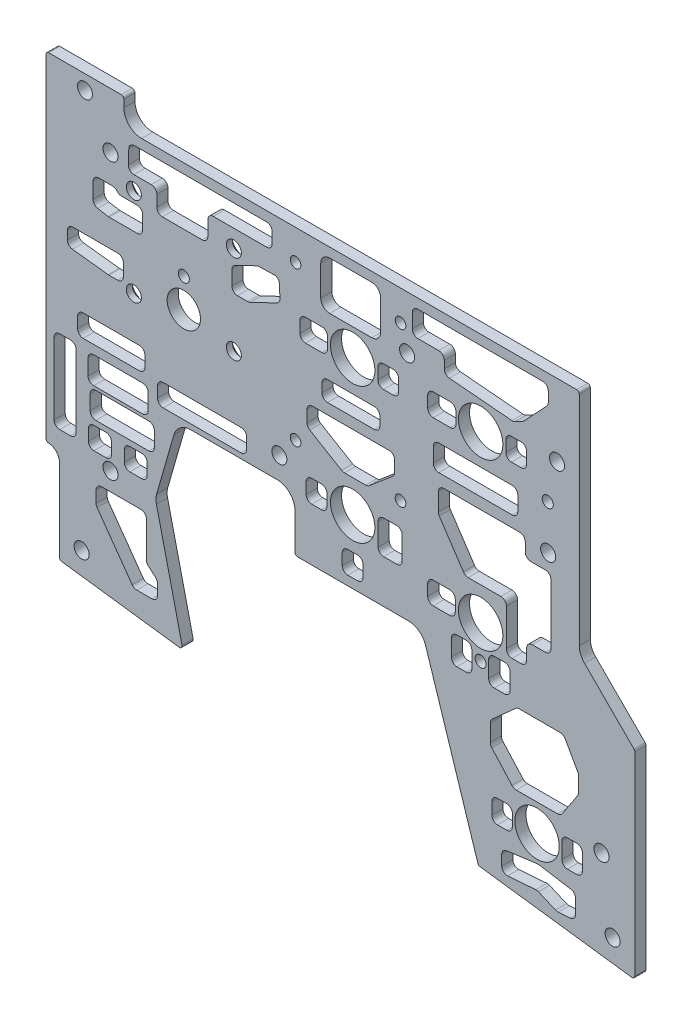
from build123d import *

# Parameters (mm, degrees)
BOSS_EXTRUDE1_DEPTH                       = 3.175
F_6_CLEARANCE_HOLE1_D                     = 4.3053
SKETCH4_R                                 = 6.35
SKETCH4_R_2                               = 1.5875
SKETCH4_R_3                               = 4.7625
CUT_EXTRUDE1_DEPTH                        = 218.405084842
CSK_FOR_6_FLAT_HEAD_MACHINE_SCREW_2_COUNT = 2
CSK_FOR_6_FLAT_HEAD_MACHINE_SCREW_2_PITCH = 28.575
CSK_FOR_6_FLAT_HEAD_MACHINE_SCREW_3_COUNT = 2
CSK_FOR_6_FLAT_HEAD_MACHINE_SCREW_3_PITCH = 38.232062788
CSK_FOR_6_FLAT_HEAD_MACHINE_SCREW_4_COUNT = 2
CSK_FOR_6_FLAT_HEAD_MACHINE_SCREW_4_PITCH = 25.4
F_0_CLEARANCE_HOLE1_D                     = 1.8542
F_1_8_0_125_DIAMETER_HOLE1_D              = 3.175
SKETCH17_R                                = 1.5875
BACKLIGHTING_HOLES_DEPTH                  = 218.405084842
SKETCH20_R                                = 1.52
SKETCH20_R_2                              = 1.520000008
SWITCH_PCB_MOUNTING_HOLES_DEPTH           = 218.405084844


with BuildPart() as part:
    # Sketch1 → Boss-Extrude1 (new body)
    with BuildSketch(Plane.XY):
        with BuildLine():
            Line((3.809986215, -91.884500325), (3.80998361, -115.403340545))
            ThreePointArc((3.80998361, -115.403340545), (3.999081622, -115.90576205), (4.472522544, -116.158821571))
            Line((4.472522544, -116.158821571), (38.023104274, -120.5758443))
            ThreePointArc((38.023104274, -120.5758443), (38.687459595, -120.33177166), (38.864463259, -119.646491316))
            Line((38.864463259, -119.646491316), (31.544635998, -88.413376307))
            ThreePointArc((31.544635998, -88.413376307), (31.412233483, -87.126289027), (31.609278422, -85.84750156))
            Line((31.609278422, -85.84750156), (36.533410401, -68.760772014))
            ThreePointArc((36.533410401, -68.760772014), (38.360231081, -66.108400459), (41.414754107, -65.0875))
            Line((41.414754107, -65.0875), (66.039990754, -65.0875))
            ThreePointArc((66.039990754, -65.0875), (69.632093202, -66.575397552), (71.119990754, -70.1675))
            Line((71.119990754, -70.1675), (71.119990754, -80.518))
            ThreePointArc((71.119990754, -80.518), (71.343175387, -81.056815367), (71.881990754, -81.28))
            Line((71.881990754, -81.28), (103.612235862, -81.28))
            ThreePointArc((103.612235862, -81.28), (106.604490402, -82.25478225), (108.448399818, -84.805034342))
            Line((108.448399818, -84.805034342), (123.423319929, -131.379161885))
            ThreePointArc((123.423319929, -131.379161885), (123.660593225, -131.731025839), (124.049283564, -131.901398021))
            Line((124.049283564, -131.901398021), (167.413526593, -137.610408921))
            ThreePointArc((167.413526593, -137.610408921), (168.015409063, -137.42782987), (168.274987552, -136.854927937))
            Line((168.274987552, -136.854927937), (168.274987552, -81.303553632))
            ThreePointArc((168.274987552, -81.303553632), (168.216983776, -81.011948907), (168.051802995, -80.764738341))
            Line((168.051802995, -80.764738341), (153.88788809, -66.600819412))
            ThreePointArc((153.88788809, -66.600819412), (152.786682817, -64.952748811), (152.399991049, -63.008717113))
            Line((152.399991049, -63.008717113), (152.399999892, -0.762021595))
            ThreePointArc((152.399999892, -0.762021595), (152.176815316, -0.223206231), (151.638, -2.1541e-05))
            Line((151.638, -2.1541e-05), (27.305, -3.804e-06))
            ThreePointArc((27.305, -3.804e-06), (23.712898123, 1.487894033), (22.22500087, 5.079996121))
            Line((22.22500087, 5.079996121), (22.225001755, 7.175496897))
            ThreePointArc((22.225001755, 7.175496897), (22.001816945, 7.7143128), (21.463001073, 7.937498421))
            Line((21.463001073, 7.937498421), (0.762001075, 7.937499892))
            ThreePointArc((0.762001075, 7.937499892), (0.223185691, 7.714315297), (1.021e-06, 7.175499945))
            Line((1.021e-06, 7.175499945), (-1.2342e-05, -87.949548922))
            ThreePointArc((-1.2342e-05, -87.949548922), (0.214550622, -88.479602508), (0.737406874, -88.711153328))
            ThreePointArc((0.737406874, -88.711153328), (2.915974038, -89.675944454), (3.809986215, -91.884500325))
        make_face()
    extrude(amount=-BOSS_EXTRUDE1_DEPTH)

    # #6 Clearance Hole1 (through all)
    with Locations(Plane(origin=(0, 0, -3.175), x_dir=(-1, 0, 0), z_dir=(0, 0, -1))):
        with Locations((-11.112500541, 3.81), (-18.414998872, -7.937503157), (-103.187497835, -15.240014658), (-143.510001128, -44.450020387), (-158.750001128, -111.125021649), (-18.414987678, -86.741003157), (-66.674991751, -58.7375), (-10.16, -110.502822935), (-146.049997068, -20.637520747), (-161.924987552, -130.483035149)):
            Hole(F_6_CLEARANCE_HOLE1_D / 2)

    # Sketch4 → Cut-Extrude1 (cut, through all)
    with BuildSketch(Plane(origin=(0, 0, -3.175), x_dir=(-1, 0, 0), z_dir=(0, 0, -1))):
        with Locations((-140.334987552, -115.57)):
            Circle(SKETCH4_R)
        with Locations((-124.205996572, -71.437521424)):
            Circle(SKETCH4_R)
        with Locations((-87.63, -62.992021649)):
            Circle(SKETCH4_R)
        with Locations((-87.63, -24.130021649)):
            Circle(SKETCH4_R)
        with Locations((-124.205996572, -24.130021649)):
            Circle(SKETCH4_R)
        with Locations((-124.205996572, -80.962521424)):
            Circle(SKETCH4_R_2)
        with Locations((-39.36999484, -36.322003157)):
            Circle(SKETCH4_R_3)
    extrude(amount=-CUT_EXTRUDE1_DEPTH, mode=Mode.SUBTRACT)

    # Sketch5 → CSK for #6 Flat Head Machine Screw (100)1 (revolve, cut)
    with BuildSketch(Plane(origin=(53.65749484, -14.097003157, -3.175), x_dir=(0, 1, 0), z_dir=(1, 0, 0))):
        Polygon((0, 0), (0, 3.175), (2.15265, 3.175), (2.15265, 1.420893136), (3.8460045, 0), align=None)
    csk_for_6_flat_head_machine_screw_100 = revolve(axis=Axis((53.65749484, -14.097003157, -9.525), (0, 0, 1)), mode=Mode.SUBTRACT)

    # CSK for _6 Flat Head Machine Screw _ 2: CSK for #6 Flat Head Machine Screw (100)1 ×2
    with Locations(*[(-i * CSK_FOR_6_FLAT_HEAD_MACHINE_SCREW_2_PITCH, 0, 0) for i in range(1, CSK_FOR_6_FLAT_HEAD_MACHINE_SCREW_2_COUNT)]):
        add(csk_for_6_flat_head_machine_screw_100, mode=Mode.SUBTRACT)

    # CSK for _6 Flat Head Machine Screw _ 3: CSK for #6 Flat Head Machine Screw (100)1 ×2
    with Locations(*[Vector(-0.7474093186836602, -0.6643638388299193, 0) * (i * CSK_FOR_6_FLAT_HEAD_MACHINE_SCREW_3_PITCH) for i in range(1, CSK_FOR_6_FLAT_HEAD_MACHINE_SCREW_3_COUNT)]):
        add(csk_for_6_flat_head_machine_screw_100, mode=Mode.SUBTRACT)

    # CSK for _6 Flat Head Machine Screw _ 4: CSK for #6 Flat Head Machine Screw (100)1 ×2
    with Locations(*[(0, -i * CSK_FOR_6_FLAT_HEAD_MACHINE_SCREW_4_PITCH, 0) for i in range(1, CSK_FOR_6_FLAT_HEAD_MACHINE_SCREW_4_COUNT)]):
        add(csk_for_6_flat_head_machine_screw_100, mode=Mode.SUBTRACT)

    # #0 Clearance Hole1 (through all)
    with Locations(Plane(origin=(0, 0, -9.525), x_dir=(-1, 0, 0), z_dir=(0, 0, -1))):
        with Locations((-39.36999484, -28.067003157)):
            Hole(F_0_CLEARANCE_HOLE1_D / 2)

    # 1/8 (0.125) Diameter Hole1 (through all)
    with Locations(Plane.XY):
        with Locations((39.36999484, -28.067003157)):
            Hole(F_1_8_0_125_DIAMETER_HOLE1_D / 2)

    # Sketch17 → Backlighting Holes (cut, through all)
    with BuildSketch(Plane(origin=(0, 0, 0), x_dir=(-1, 0, 0), z_dir=(0, 0, -1))):
        with Locations((-143.386523366, -31.863003467)):
            Circle(SKETCH17_R)
        with BuildLine():
            Line((-141.954401082, -2.794778722), (-106.266230354, -2.794778722))
            ThreePointArc((-106.266230354, -2.794778722), (-105.143698339, -3.259746707), (-104.678730354, -4.382278722))
            Line((-104.678730354, -4.382278722), (-104.678730354, -8.460645735))
            ThreePointArc((-104.678730354, -8.460645735), (-105.143698339, -9.58317775), (-106.266230354, -10.048145735))
            Line((-106.266230354, -10.048145735), (-112.220916292, -10.048145735))
            ThreePointArc((-112.220916292, -10.048145735), (-113.343448308, -10.513113719), (-113.808416292, -11.635645735))
            Line((-113.808416292, -11.635645735), (-113.808416292, -13.776242931))
            ThreePointArc((-113.808416292, -13.776242931), (-114.2259722, -14.849269991), (-115.258982682, -15.357826136))
            Line((-115.258982682, -15.357826136), (-133.159037644, -16.907614445))
            ThreePointArc((-133.159037644, -16.907614445), (-133.597603316, -16.884612116), (-134.01308492, -16.742330728))
            Line((-134.01308492, -16.742330728), (-136.087372049, -15.692058763))
            ThreePointArc((-136.087372049, -15.692058763), (-136.323169987, -15.545450468), (-136.529817195, -15.360000768))
            Line((-136.529817195, -15.360000768), (-143.113959892, -8.318487666))
            ThreePointArc((-143.113959892, -8.318487666), (-143.431045227, -7.817065459), (-143.541901082, -7.234246174))
            Line((-143.541901082, -7.234246174), (-143.541901082, -4.382278722))
            ThreePointArc((-143.541901082, -4.382278722), (-143.076933097, -3.259746707), (-141.954401082, -2.794778722))
        make_face()
        with BuildLine():
            Line((-93.066886854, -2.707621709), (-81.044131338, -2.707621709))
            ThreePointArc((-81.044131338, -2.707621709), (-79.248080114, -3.451570485), (-78.504131338, -5.247621709))
            Line((-78.504131338, -5.247621709), (-78.504131338, -13.895603213))
            ThreePointArc((-78.504131338, -13.895603213), (-79.248080114, -15.691654437), (-81.044131338, -16.435603213))
            Line((-81.044131338, -16.435603213), (-93.066886854, -16.435603213))
            ThreePointArc((-93.066886854, -16.435603213), (-94.862938078, -15.691654437), (-95.606886854, -13.895603213))
            Line((-95.606886854, -13.895603213), (-95.606886854, -5.247621709))
            ThreePointArc((-95.606886854, -5.247621709), (-94.862938078, -3.451570485), (-93.066886854, -2.707621709))
        make_face()
        with BuildLine():
            Line((-72.561223983, -22.437005333), (-72.561223983, -25.636983817))
            ThreePointArc((-72.561223983, -25.636983817), (-73.026191968, -26.759515832), (-74.148723983, -27.224483817))
            Line((-74.148723983, -27.224483817), (-78.851026484, -27.224483817))
            ThreePointArc((-78.851026484, -27.224483817), (-79.973558499, -26.759515832), (-80.438526484, -25.636983817))
            Line((-80.438526484, -25.636983817), (-80.438526484, -22.437005333))
            ThreePointArc((-80.438526484, -22.437005333), (-79.973558499, -21.314473318), (-78.851026484, -20.849505333))
            Line((-78.851026484, -20.849505333), (-74.148723983, -20.849505333))
            ThreePointArc((-74.148723983, -20.849505333), (-73.026191968, -21.314473318), (-72.561223983, -22.437005333))
        make_face()
        with BuildLine():
            Line((-99.201764697, -21.196263474), (-96.421279554, -21.196263474))
            ThreePointArc((-96.421279554, -21.196263474), (-95.298747539, -21.661231459), (-94.833779554, -22.783763474))
            Line((-94.833779554, -22.783763474), (-94.833779554, -25.981791856))
            ThreePointArc((-94.833779554, -25.981791856), (-95.298747539, -27.104323871), (-96.421279554, -27.569291856))
            Line((-96.421279554, -27.569291856), (-99.201764697, -27.569291856))
            ThreePointArc((-99.201764697, -27.569291856), (-100.324296712, -27.104323871), (-100.789264697, -25.981791856))
            Line((-100.789264697, -25.981791856), (-100.789264697, -22.783763474))
            ThreePointArc((-100.789264697, -22.783763474), (-100.324296712, -21.661231459), (-99.201764697, -21.196263474))
        make_face()
        with BuildLine():
            Line((-109.079202691, -22.654901792), (-109.079202691, -25.854880276))
            ThreePointArc((-109.079202691, -25.854880276), (-109.544170675, -26.977412291), (-110.666702691, -27.442380276))
            Line((-110.666702691, -27.442380276), (-115.553648816, -27.442380276))
            ThreePointArc((-115.553648816, -27.442380276), (-116.676180832, -26.977412291), (-117.141148816, -25.854880276))
            Line((-117.141148816, -25.854880276), (-117.141148816, -22.654901792))
            ThreePointArc((-117.141148816, -22.654901792), (-116.676180832, -21.532369777), (-115.553648816, -21.067401792))
            Line((-115.553648816, -21.067401792), (-110.666702691, -21.067401792))
            ThreePointArc((-110.666702691, -21.067401792), (-109.544170675, -21.532369777), (-109.079202691, -22.654901792))
        make_face()
        with BuildLine():
            Line((-135.77376345, -20.881443358), (-132.993278308, -20.881443358))
            ThreePointArc((-132.993278308, -20.881443358), (-131.870746293, -21.346411343), (-131.405778308, -22.468943358))
            Line((-131.405778308, -22.468943358), (-131.405778308, -25.666971739))
            ThreePointArc((-131.405778308, -25.666971739), (-131.870746293, -26.789503754), (-132.993278308, -27.254471739))
            Line((-132.993278308, -27.254471739), (-135.77376345, -27.254471739))
            ThreePointArc((-135.77376345, -27.254471739), (-136.896295465, -26.789503754), (-137.36126345, -25.666971739))
            Line((-137.36126345, -25.666971739), (-137.36126345, -22.468943358))
            ThreePointArc((-137.36126345, -22.468943358), (-136.896295465, -21.346411343), (-135.77376345, -20.881443358))
        make_face()
        with BuildLine():
            Line((-93.818924612, -33.08533813), (-80.438526484, -33.08533813))
            ThreePointArc((-80.438526484, -33.08533813), (-79.315994469, -33.550306115), (-78.851026484, -34.67283813))
            Line((-78.851026484, -34.67283813), (-78.851026484, -37.195409517))
            ThreePointArc((-78.851026484, -37.195409517), (-79.315994469, -38.317941532), (-80.438526484, -38.782909517))
            Line((-80.438526484, -38.782909517), (-93.818924612, -38.782909517))
            ThreePointArc((-93.818924612, -38.782909517), (-94.941456627, -38.317941532), (-95.406424612, -37.195409517))
            Line((-95.406424612, -37.195409517), (-95.406424612, -34.67283813))
            ThreePointArc((-95.406424612, -34.67283813), (-94.941456627, -33.550306115), (-93.818924612, -33.08533813))
        make_face()
        with BuildLine():
            Line((-133.234599807, -32.906340689), (-112.254202691, -32.906340689))
            ThreePointArc((-112.254202691, -32.906340689), (-111.131670675, -33.371308674), (-110.666702691, -34.493840689))
            Line((-110.666702691, -34.493840689), (-110.666702691, -38.654468066))
            ThreePointArc((-110.666702691, -38.654468066), (-111.131670675, -39.777000081), (-112.254202691, -40.241968066))
            Line((-112.254202691, -40.241968066), (-133.234599807, -40.241968066))
            ThreePointArc((-133.234599807, -40.241968066), (-134.357131822, -39.777000081), (-134.822099807, -38.654468066))
            Line((-134.822099807, -38.654468066), (-134.822099807, -34.493840689))
            ThreePointArc((-134.822099807, -34.493840689), (-134.357131822, -33.371308674), (-133.234599807, -32.906340689))
        make_face()
        with BuildLine():
            Line((-98.049772798, -41.846894397), (-76.171732084, -41.846894397))
            ThreePointArc((-76.171732084, -41.846894397), (-75.049200069, -42.311862382), (-74.584232084, -43.434394397))
            Line((-74.584232084, -43.434394397), (-74.584232084, -46.777135575))
            ThreePointArc((-74.584232084, -46.777135575), (-74.791626469, -47.561651185), (-75.359620735, -48.14118521))
            Line((-75.359620735, -48.14118521), (-84.465669031, -53.562633937))
            ThreePointArc((-84.465669031, -53.562633937), (-84.856634648, -53.729202648), (-85.277780379, -53.786084302))
            Line((-85.277780379, -53.786084302), (-91.347435578, -53.786084302))
            ThreePointArc((-91.347435578, -53.786084302), (-91.895147409, -53.68860712), (-92.375596997, -53.408146349))
            Line((-92.375596997, -53.408146349), (-99.077934217, -47.710973092))
            ThreePointArc((-99.077934217, -47.710973092), (-99.490668787, -47.167725534), (-99.637272798, -46.501411045))
            Line((-99.637272798, -46.501411045), (-99.637272798, -43.434394397))
            ThreePointArc((-99.637272798, -43.434394397), (-99.172304813, -42.311862382), (-98.049772798, -41.846894397))
        make_face()
        with BuildLine():
            Line((-135.378861596, -43.434394397), (-113.69903477, -43.434394397))
            ThreePointArc((-113.69903477, -43.434394397), (-112.576502755, -43.899362382), (-112.11153477, -45.021894397))
            Line((-112.11153477, -45.021894397), (-112.11153477, -50.042866363))
            ThreePointArc((-112.11153477, -50.042866363), (-112.179838766, -50.503517806), (-112.37887304, -50.924529143))
            Line((-112.37887304, -50.924529143), (-119.322930241, -61.322244422))
            ThreePointArc((-119.322930241, -61.322244422), (-119.894587933, -61.840545197), (-120.64309197, -62.028081642))
            Line((-120.64309197, -62.028081642), (-129.987144718, -62.028081642))
            ThreePointArc((-129.987144718, -62.028081642), (-131.109676734, -62.493049627), (-131.574644718, -63.615581642))
            Line((-131.574644718, -63.615581642), (-131.574644718, -74.171525295))
            ThreePointArc((-131.574644718, -74.171525295), (-132.039612703, -75.29405731), (-133.162144718, -75.759025295))
            Line((-133.162144718, -75.759025295), (-135.77376345, -75.759025295))
            ThreePointArc((-135.77376345, -75.759025295), (-136.896295465, -75.29405731), (-137.36126345, -74.171525295))
            Line((-137.36126345, -74.171525295), (-137.36126345, -71.06167269))
            ThreePointArc((-137.36126345, -71.06167269), (-137.826231435, -69.939140675), (-138.94876345, -69.47417269))
            Line((-138.94876345, -69.47417269), (-142.70584419, -69.47417269))
            ThreePointArc((-142.70584419, -69.47417269), (-143.828376205, -69.009204705), (-144.29334419, -67.88667269))
            Line((-144.29334419, -67.88667269), (-144.29334419, -50.696173086))
            ThreePointArc((-144.29334419, -50.696173086), (-143.828376205, -49.573641071), (-142.70584419, -49.108673086))
            Line((-142.70584419, -49.108673086), (-138.553861596, -49.108673086))
            ThreePointArc((-138.553861596, -49.108673086), (-137.431329581, -48.643705101), (-136.966361596, -47.521173086))
            Line((-136.966361596, -47.521173086), (-136.966361596, -45.021894397))
            ThreePointArc((-136.966361596, -45.021894397), (-136.501393611, -43.899362382), (-135.378861596, -43.434394397))
        make_face()
        with BuildLine():
            Line((-55.728459479, -57.317644253), (-33.458660867, -57.317644253))
            ThreePointArc((-33.458660867, -57.317644253), (-32.336128852, -57.782612238), (-31.871160867, -58.905144253))
            Line((-31.871160867, -58.905144253), (-31.871160867, -62.020016774))
            ThreePointArc((-31.871160867, -62.020016774), (-32.336128852, -63.142548789), (-33.458660867, -63.607516774))
            Line((-33.458660867, -63.607516774), (-55.728459479, -63.607516774))
            ThreePointArc((-55.728459479, -63.607516774), (-56.850991494, -63.142548789), (-57.315959479, -62.020016774))
            Line((-57.315959479, -62.020016774), (-57.315959479, -58.905144253))
            ThreePointArc((-57.315959479, -58.905144253), (-56.850991494, -57.782612238), (-55.728459479, -57.317644253))
        make_face()
        with BuildLine():
            Line((-78.702060135, -59.817431846), (-75.921574993, -59.817431846))
            ThreePointArc((-75.921574993, -59.817431846), (-74.799042977, -60.282399831), (-74.334074993, -61.404931846))
            Line((-74.334074993, -61.404931846), (-74.334074993, -64.602960227))
            ThreePointArc((-74.334074993, -64.602960227), (-74.799042977, -65.725492242), (-75.921574993, -66.190460227))
            Line((-75.921574993, -66.190460227), (-78.702060135, -66.190460227))
            ThreePointArc((-78.702060135, -66.190460227), (-79.82459215, -65.725492242), (-80.289560135, -64.602960227))
            Line((-80.289560135, -64.602960227), (-80.289560135, -61.404931846))
            ThreePointArc((-80.289560135, -61.404931846), (-79.82459215, -60.282399831), (-78.702060135, -59.817431846))
        make_face()
        with BuildLine():
            Line((-89.018858203, -72.254815082), (-86.23837306, -72.254815082))
            ThreePointArc((-86.23837306, -72.254815082), (-85.115841045, -72.719783067), (-84.65087306, -73.842315082))
            Line((-84.65087306, -73.842315082), (-84.65087306, -77.040343463))
            ThreePointArc((-84.65087306, -77.040343463), (-85.115841045, -78.162875478), (-86.23837306, -78.627843463))
            Line((-86.23837306, -78.627843463), (-89.018858203, -78.627843463))
            ThreePointArc((-89.018858203, -78.627843463), (-90.141390218, -78.162875478), (-90.606358203, -77.040343463))
            Line((-90.606358203, -77.040343463), (-90.606358203, -73.842315082))
            ThreePointArc((-90.606358203, -73.842315082), (-90.141390218, -72.719783067), (-89.018858203, -72.254815082))
        make_face()
        with BuildLine():
            Line((-109.075626661, -69.247984793), (-109.075626661, -72.447963277))
            ThreePointArc((-109.075626661, -72.447963277), (-109.540594645, -73.570495292), (-110.663126661, -74.035463277))
            Line((-110.663126661, -74.035463277), (-115.365429161, -74.035463277))
            ThreePointArc((-115.365429161, -74.035463277), (-116.487961176, -73.570495292), (-116.952929161, -72.447963277))
            Line((-116.952929161, -72.447963277), (-116.952929161, -69.247984793))
            ThreePointArc((-116.952929161, -69.247984793), (-116.487961176, -68.125452778), (-115.365429161, -67.660484793))
            Line((-115.365429161, -67.660484793), (-110.663126661, -67.660484793))
            ThreePointArc((-110.663126661, -67.660484793), (-109.540594645, -68.125452778), (-109.075626661, -69.247984793))
        make_face()
        with BuildLine():
            Line((-148.370050761, -88.076585208), (-151.957151361, -94.466108152))
            ThreePointArc((-151.957151361, -94.466108152), (-152.115789699, -94.859097254), (-152.169841465, -95.27943636))
            Line((-152.169841465, -95.27943636), (-152.169841465, -99.49161714))
            ThreePointArc((-152.169841465, -99.49161714), (-152.099935986, -99.968481356), (-151.89610216, -100.405217006))
            Line((-151.89610216, -100.405217006), (-147.55983031, -106.991698188))
            ThreePointArc((-147.55983031, -106.991698188), (-146.96032319, -107.540670714), (-146.17213864, -107.739529297))
            Line((-146.17213864, -107.739529297), (-134.392603774, -107.739529297))
            ThreePointArc((-134.392603774, -107.739529297), (-133.716535226, -107.595755795), (-133.157475142, -107.189318439))
            Line((-133.157475142, -107.189318439), (-127.395632153, -100.784991214))
            ThreePointArc((-127.395632153, -100.784991214), (-127.07956224, -100.268864333), (-126.96932981, -99.673771097))
            Line((-126.96932981, -99.673771097), (-126.96932981, -94.86683815))
            ThreePointArc((-126.96932981, -94.86683815), (-127.113103312, -94.190769602), (-127.519540668, -93.631709518))
            Line((-127.519540668, -93.631709518), (-134.162932699, -87.654784784))
            ThreePointArc((-134.162932699, -87.654784784), (-134.67905958, -87.338714871), (-135.274152816, -87.228482441))
            Line((-135.274152816, -87.228482441), (-146.92130989, -87.228482441))
            ThreePointArc((-146.92130989, -87.228482441), (-147.760673997, -87.456100045), (-148.370050761, -88.076585208))
        make_face()
        with BuildLine():
            Line((-132.626442112, -79.356885677), (-132.626442112, -84.055009483))
            ThreePointArc((-132.626442112, -84.055009483), (-132.161474127, -85.177541498), (-131.038942112, -85.642509483))
            Line((-131.038942112, -85.642509483), (-128.087367926, -85.642509483))
            ThreePointArc((-128.087367926, -85.642509483), (-126.964835911, -85.177541498), (-126.499867926, -84.055009483))
            Line((-126.499867926, -84.055009483), (-126.499867926, -79.36528336))
            ThreePointArc((-126.499867926, -79.36528336), (-126.963240164, -78.244349364), (-128.082851263, -77.777789785))
            Line((-128.082851263, -77.777789785), (-131.034425449, -77.769392102))
            ThreePointArc((-131.034425449, -77.769392102), (-132.159876108, -78.232757914), (-132.626442112, -79.356885677))
        make_face()
        with BuildLine():
            Line((-121.693780245, -79.413986581), (-121.693780245, -84.111339186))
            ThreePointArc((-121.693780245, -84.111339186), (-121.22881226, -85.233871201), (-120.106280245, -85.698839186))
            Line((-120.106280245, -85.698839186), (-117.42576388, -85.698839186))
            ThreePointArc((-117.42576388, -85.698839186), (-116.303231865, -85.233871201), (-115.83826388, -84.111339186))
            Line((-115.83826388, -84.111339186), (-115.83826388, -79.421613063))
            ThreePointArc((-115.83826388, -79.421613063), (-116.301636118, -78.300679067), (-117.421247217, -77.834119488))
            Line((-117.421247217, -77.834119488), (-120.101763581, -77.826493007))
            ThreePointArc((-120.101763581, -77.826493007), (-121.227214241, -78.289858819), (-121.693780245, -79.413986581))
        make_face()
        with BuildLine():
            Line((-101.797793639, -60.937531848), (-101.797793639, -67.347277648))
            ThreePointArc((-101.797793639, -67.347277648), (-101.332825654, -68.469809663), (-100.210293639, -68.934777648))
            Line((-100.210293639, -68.934777648), (-96.497621556, -68.934777648))
            ThreePointArc((-96.497621556, -68.934777648), (-95.375089541, -68.469809663), (-94.910121556, -67.347277648))
            Line((-94.910121556, -67.347277648), (-94.910121556, -60.948094972))
            ThreePointArc((-94.910121556, -60.948094972), (-95.373493794, -59.827160976), (-96.493104893, -59.360601397))
            Line((-96.493104893, -59.360601397), (-100.205776975, -59.350038274))
            ThreePointArc((-100.205776975, -59.350038274), (-101.331227635, -59.813404086), (-101.797793639, -60.937531848))
        make_face()
        with BuildLine():
            Line((-153.280142062, -113.845353265), (-153.280142062, -118.411545226))
            ThreePointArc((-153.280142062, -118.411545226), (-152.815174077, -119.534077241), (-151.692642062, -119.999045226))
            Line((-151.692642062, -119.999045226), (-149.012125698, -119.999045226))
            ThreePointArc((-149.012125698, -119.999045226), (-147.889593683, -119.534077241), (-147.424625698, -118.411545226))
            Line((-147.424625698, -118.411545226), (-147.424625698, -113.852979747))
            ThreePointArc((-147.424625698, -113.852979747), (-147.887997935, -112.732045751), (-149.007609034, -112.265486172))
            Line((-149.007609034, -112.265486172), (-151.688125399, -112.25785969))
            ThreePointArc((-151.688125399, -112.25785969), (-152.813576058, -112.721225502), (-153.280142062, -113.845353265))
        make_face()
        with BuildLine():
            Line((-133.269582538, -114.060259814), (-133.269582538, -117.452210954))
            ThreePointArc((-133.269582538, -117.452210954), (-132.804614553, -118.57474297), (-131.682082538, -119.039710954))
            Line((-131.682082538, -119.039710954), (-129.001566173, -119.039710954))
            ThreePointArc((-129.001566173, -119.039710954), (-127.879034158, -118.57474297), (-127.414066173, -117.452210954))
            Line((-127.414066173, -117.452210954), (-127.414066173, -114.067886296))
            ThreePointArc((-127.414066173, -114.067886296), (-127.877438411, -112.9469523), (-128.99704951, -112.480392721))
            Line((-128.99704951, -112.480392721), (-131.677565874, -112.47276624))
            ThreePointArc((-131.677565874, -112.47276624), (-132.803016533, -112.936132052), (-133.269582538, -114.060259814))
        make_face()
        with BuildLine():
            Line((-150.008386995, -124.475096267), (-140.89017679, -122.992460461))
            ThreePointArc((-140.89017679, -122.992460461), (-140.658124621, -122.972044218), (-140.425582982, -122.985807167))
            Line((-140.425582982, -122.985807167), (-131.613885455, -124.16070017))
            ThreePointArc((-131.613885455, -124.16070017), (-130.629285574, -124.688549111), (-130.23619536, -125.734274463))
            Line((-130.23619536, -125.734274463), (-130.23619536, -128.629666423))
            ThreePointArc((-130.23619536, -128.629666423), (-130.742753538, -129.792301803), (-131.939150985, -130.212962431))
            Line((-131.939150985, -130.212962431), (-139.978069251, -129.626755984))
            ThreePointArc((-139.978069251, -129.626755984), (-140.352556122, -129.64382753), (-140.712598595, -129.748236689))
            Line((-140.712598595, -129.748236689), (-145.647124424, -131.837991292))
            ThreePointArc((-145.647124424, -131.837991292), (-146.007166897, -131.94240045), (-146.381653768, -131.959471997))
            Line((-146.381653768, -131.959471997), (-149.869058718, -131.705166729))
            ThreePointArc((-149.869058718, -131.705166729), (-150.916238473, -131.202812543), (-151.341103093, -130.121870721))
            Line((-151.341103093, -130.121870721), (-151.341103093, -126.042017265))
            ThreePointArc((-151.341103093, -126.042017265), (-150.962864375, -125.01350212), (-150.008386995, -124.475096267))
        make_face()
        with BuildLine():
            Line((-63.040443501, -2.794778722), (-25.227680135, -2.794778722))
            ThreePointArc((-25.227680135, -2.794778722), (-24.123242224, -3.241939671), (-23.640992035, -4.331513335))
            Line((-23.640992035, -4.331513335), (-23.510506479, -8.409880348))
            ThreePointArc((-23.510506479, -8.409880348), (-23.956855528, -9.565083646), (-25.097194578, -10.048145735))
            Line((-25.097194578, -10.048145735), (-30.072502828, -10.048145735))
            ThreePointArc((-30.072502828, -10.048145735), (-31.195034843, -10.513113719), (-31.660002828, -11.635645735))
            Line((-31.660002828, -11.635645735), (-31.660002828, -14.848103213))
            ThreePointArc((-31.660002828, -14.848103213), (-32.124970813, -15.970635228), (-33.247502828, -16.435603213))
            Line((-33.247502828, -16.435603213), (-44.640077745, -16.435603213))
            ThreePointArc((-44.640077745, -16.435603213), (-45.76260976, -15.970635228), (-46.227577745, -14.848103213))
            Line((-46.227577745, -14.848103213), (-46.227577745, -10.622419331))
            ThreePointArc((-46.227577745, -10.622419331), (-46.69254573, -9.499887316), (-47.815077745, -9.034919331))
            Line((-47.815077745, -9.034919331), (-63.040443501, -9.034919331))
            ThreePointArc((-63.040443501, -9.034919331), (-64.162975516, -8.569951347), (-64.627943501, -7.447419331))
            Line((-64.627943501, -7.447419331), (-64.627943501, -4.382278722))
            ThreePointArc((-64.627943501, -4.382278722), (-64.162975516, -3.259746707), (-63.040443501, -2.794778722))
        make_face()
        with BuildLine():
            Line((-14.759070115, -23.570795807), (-17.723350514, -24.090332102))
            ThreePointArc((-17.723350514, -24.090332102), (-17.85986161, -24.1081969), (-17.997407205, -24.114166799))
            Line((-17.997407205, -24.114166799), (-26.038134643, -24.114166799))
            ThreePointArc((-26.038134643, -24.114166799), (-27.160666659, -23.649198814), (-27.625634643, -22.526666799))
            Line((-27.625634643, -22.526666799), (-27.625634643, -18.73663863))
            ThreePointArc((-27.625634643, -18.73663863), (-27.160666659, -17.614106615), (-26.038134643, -17.14913863))
            Line((-26.038134643, -17.14913863), (-21.56318401, -17.14913863))
            ThreePointArc((-21.56318401, -17.14913863), (-20.962036583, -17.030916691), (-20.45042467, -16.693858971))
            Line((-20.45042467, -16.693858971), (-20.120376939, -16.369484217))
            ThreePointArc((-20.120376939, -16.369484217), (-19.608765026, -16.032426497), (-19.007617599, -15.914204558))
            Line((-19.007617599, -15.914204558), (-15.033126806, -15.914204558))
            ThreePointArc((-15.033126806, -15.914204558), (-13.910594791, -16.379172543), (-13.445626806, -17.501704558))
            Line((-13.445626806, -17.501704558), (-13.445626806, -22.007130504))
            ThreePointArc((-13.445626806, -22.007130504), (-13.817556725, -23.02818174), (-14.759070115, -23.570795807))
        make_face()
        with BuildLine():
            Line((-7.687541654, -31.784293999), (-20.492686013, -31.784293999))
            ThreePointArc((-20.492686013, -31.784293999), (-21.615218028, -32.249261984), (-22.080186013, -33.371793999))
            Line((-22.080186013, -33.371793999), (-22.080186013, -36.910471607))
            ThreePointArc((-22.080186013, -36.910471607), (-21.615218028, -38.033003622), (-20.492686013, -38.497971607))
            Line((-20.492686013, -38.497971607), (-17.950353288, -38.497971607))
            ThreePointArc((-17.950353288, -38.497971607), (-17.85932805, -38.495359823), (-17.768602325, -38.487533064))
            Line((-17.768602325, -38.487533064), (-7.505790692, -37.304778971))
            ThreePointArc((-7.505790692, -37.304778971), (-6.502491887, -36.784038157), (-6.100041654, -35.727717515))
            Line((-6.100041654, -35.727717515), (-6.100041654, -33.371793999))
            ThreePointArc((-6.100041654, -33.371793999), (-6.565009639, -32.249261984), (-7.687541654, -31.784293999))
        make_face()
        with BuildLine():
            Line((-54.017740764, -18.035287573), (-60.157042526, -15.096331818))
            ThreePointArc((-60.157042526, -15.096331818), (-60.467014119, -14.985764634), (-60.793122931, -14.941486718))
            Line((-60.793122931, -14.941486718), (-65.080511102, -14.808059257))
            ThreePointArc((-65.080511102, -14.808059257), (-66.216963147, -15.237884918), (-66.716623456, -16.345410507))
            Line((-66.716623456, -16.345410507), (-66.828160076, -19.929386283))
            ThreePointArc((-66.828160076, -19.929386283), (-66.597618952, -20.803935361), (-65.926889232, -21.410653537))
            Line((-65.926889232, -21.410653537), (-58.302186243, -25.06068828))
            ThreePointArc((-58.302186243, -25.06068828), (-57.968176642, -25.176909518), (-57.616725286, -25.216301578))
            Line((-57.616725286, -25.216301578), (-54.703201722, -25.216301578))
            ThreePointArc((-54.703201722, -25.216301578), (-53.580669707, -24.751333593), (-53.115701722, -23.628801578))
            Line((-53.115701722, -23.628801578), (-53.115701722, -19.467174274))
            ThreePointArc((-53.115701722, -19.467174274), (-53.360010462, -18.621010289), (-54.017740764, -18.035287573))
        make_face()
        with BuildLine():
            Line((-24.6224405, -111.814164533), (-14.598619876, -97.7476148))
            ThreePointArc((-14.598619876, -97.7476148), (-14.379412328, -97.309967584), (-14.303951845, -96.826342988))
            Line((-14.303951845, -96.826342988), (-14.303951845, -93.511282851))
            ThreePointArc((-14.303951845, -93.511282851), (-14.76891983, -92.388750836), (-15.891451845, -91.923782851))
            Line((-15.891451845, -91.923782851), (-27.085798239, -91.923782851))
            ThreePointArc((-27.085798239, -91.923782851), (-28.208330254, -92.388750836), (-28.673298239, -93.511282851))
            Line((-28.673298239, -93.511282851), (-28.673298239, -103.655996614))
            ThreePointArc((-28.673298239, -103.655996614), (-28.814136203, -104.309697772), (-29.2116607, -104.847410343))
            Line((-29.2116607, -104.847410343), (-31.332798405, -106.715246122))
            ThreePointArc((-31.332798405, -106.715246122), (-31.730322903, -107.252958694), (-31.871160867, -107.906659851))
            Line((-31.871160867, -107.906659851), (-31.871160867, -110.892892721))
            ThreePointArc((-31.871160867, -110.892892721), (-31.406192882, -112.015424736), (-30.283660867, -112.480392721))
            Line((-30.283660867, -112.480392721), (-25.915272469, -112.480392721))
            ThreePointArc((-25.915272469, -112.480392721), (-25.188073304, -112.304040348), (-24.6224405, -111.814164533))
        make_face()
        with BuildLine():
            Line((-2.29761601, -61.626856011), (-2.29761601, -82.185869764))
            ThreePointArc((-2.29761601, -82.185869764), (-2.762583995, -83.308401779), (-3.88511601, -83.773369764))
            Line((-3.88511601, -83.773369764), (-6.992649062, -83.773369764))
            ThreePointArc((-6.992649062, -83.773369764), (-8.115181078, -83.308401779), (-8.580149062, -82.185869764))
            Line((-8.580149062, -82.185869764), (-8.580149062, -61.626856011))
            ThreePointArc((-8.580149062, -61.626856011), (-8.115181078, -60.504323996), (-6.992649062, -60.039356011))
            Line((-6.992649062, -60.039356011), (-3.88511601, -60.039356011))
            ThreePointArc((-3.88511601, -60.039356011), (-2.762583995, -60.504323996), (-2.29761601, -61.626856011))
        make_face()
        with BuildLine():
            Line((-26.655047824, -51.539248395), (-10.603917238, -51.539248395))
            ThreePointArc((-10.603917238, -51.539248395), (-9.481385223, -52.00421638), (-9.016417238, -53.126748395))
            Line((-9.016417238, -53.126748395), (-9.016417238, -56.241620915))
            ThreePointArc((-9.016417238, -56.241620915), (-9.481385223, -57.364152931), (-10.603917238, -57.829120915))
            Line((-10.603917238, -57.829120915), (-26.655047824, -57.829120915))
            ThreePointArc((-26.655047824, -57.829120915), (-27.777579839, -57.364152931), (-28.242547824, -56.241620915))
            Line((-28.242547824, -56.241620915), (-28.242547824, -53.126748395))
            ThreePointArc((-28.242547824, -53.126748395), (-27.777579839, -52.00421638), (-26.655047824, -51.539248395))
        make_face()
        with BuildLine():
            Line((-27.60517637, -60.384955933), (-13.586583905, -60.384955933))
            ThreePointArc((-13.586583905, -60.384955933), (-12.464051889, -60.849923918), (-11.999083905, -61.972455933))
            Line((-11.999083905, -61.972455933), (-11.999083905, -66.454374219))
            ThreePointArc((-11.999083905, -66.454374219), (-12.464051889, -67.576906234), (-13.586583905, -68.041874219))
            Line((-13.586583905, -68.041874219), (-27.60517637, -68.041874219))
            ThreePointArc((-27.60517637, -68.041874219), (-28.727708385, -67.576906234), (-29.19267637, -66.454374219))
            Line((-29.19267637, -66.454374219), (-29.19267637, -61.972455933))
            ThreePointArc((-29.19267637, -61.972455933), (-28.727708385, -60.849923918), (-27.60517637, -60.384955933))
        make_face()
        with BuildLine():
            Line((-29.346999145, -68.903193864), (-14.201372964, -68.903193864))
            ThreePointArc((-14.201372964, -68.903193864), (-13.078840949, -69.368161849), (-12.613872964, -70.490693864))
            Line((-12.613872964, -70.490693864), (-12.613872964, -74.741182613))
            ThreePointArc((-12.613872964, -74.741182613), (-13.078840949, -75.863714628), (-14.201372964, -76.328682613))
            Line((-14.201372964, -76.328682613), (-29.346999145, -76.328682613))
            ThreePointArc((-29.346999145, -76.328682613), (-30.46953116, -75.863714628), (-30.934499145, -74.741182613))
            Line((-30.934499145, -74.741182613), (-30.934499145, -70.490693864))
            ThreePointArc((-30.934499145, -70.490693864), (-30.46953116, -69.368161849), (-29.346999145, -68.903193864))
        make_face()
        with BuildLine():
            Line((-27.328678764, -77.907601358), (-23.948133638, -77.907601358))
            ThreePointArc((-23.948133638, -77.907601358), (-22.825601623, -78.372569343), (-22.360633638, -79.495101358))
            Line((-22.360633638, -79.495101358), (-22.360633638, -82.609973878))
            ThreePointArc((-22.360633638, -82.609973878), (-22.825601623, -83.732505893), (-23.948133638, -84.197473878))
            Line((-23.948133638, -84.197473878), (-27.328678764, -84.197473878))
            ThreePointArc((-27.328678764, -84.197473878), (-28.45121078, -83.732505893), (-28.916178764, -82.609973878))
            Line((-28.916178764, -82.609973878), (-28.916178764, -79.495101358))
            ThreePointArc((-28.916178764, -79.495101358), (-28.45121078, -78.372569343), (-27.328678764, -77.907601358))
        make_face()
        with BuildLine():
            Line((-17.11922324, -77.821029951), (-13.667032811, -77.821029951))
            ThreePointArc((-13.667032811, -77.821029951), (-12.544500796, -78.285997936), (-12.079532811, -79.408529951))
            Line((-12.079532811, -79.408529951), (-12.079532811, -82.523402472))
            ThreePointArc((-12.079532811, -82.523402472), (-12.544500796, -83.645934487), (-13.667032811, -84.110902472))
            Line((-13.667032811, -84.110902472), (-17.11922324, -84.110902472))
            ThreePointArc((-17.11922324, -84.110902472), (-18.241755255, -83.645934487), (-18.70672324, -82.523402472))
            Line((-18.70672324, -82.523402472), (-18.70672324, -79.408529951))
            ThreePointArc((-18.70672324, -79.408529951), (-18.241755255, -78.285997936), (-17.11922324, -77.821029951))
        make_face()
    extrude(amount=BACKLIGHTING_HOLES_DEPTH, mode=Mode.SUBTRACT)

    # Sketch20 → Switch PCB Mounting Holes (cut, through all)
    with BuildSketch(Plane.XY):
        with Locations((101.311694799, -8.663003362)):
            Circle(SKETCH20_R)
        with Locations((71.311694799, -8.663003362)):
            Circle(SKETCH20_R_2)
        with Locations((101.311694799, -52.663003362)):
            Circle(SKETCH20_R_2)
        with Locations((71.311694799, -52.663003362)):
            Circle(SKETCH20_R_2)
    extrude(amount=-SWITCH_PCB_MOUNTING_HOLES_DEPTH, mode=Mode.SUBTRACT)


solid = part.part
